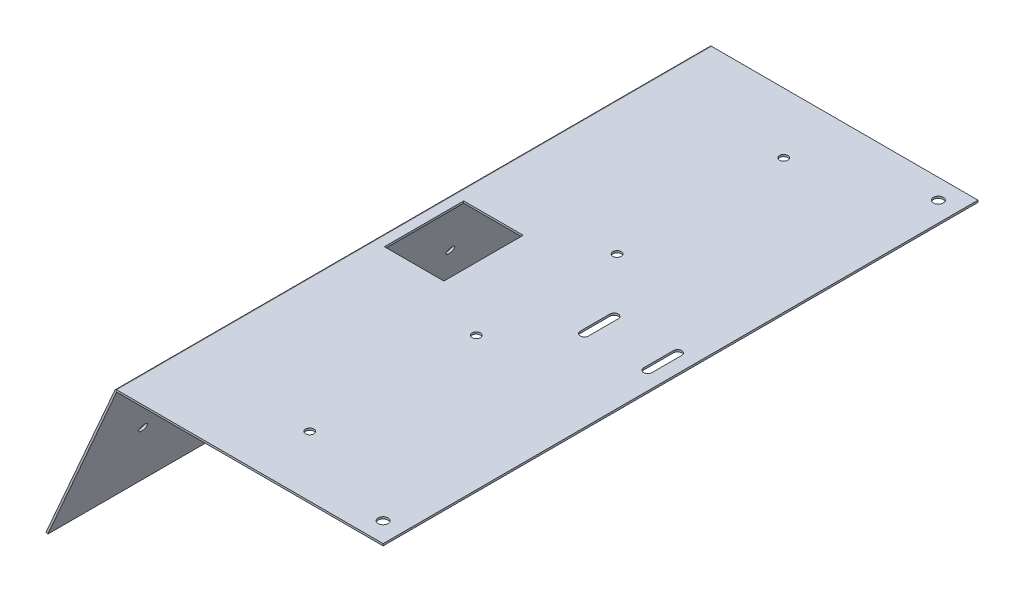
from build123d import *

# Parameters (mm, degrees)
T_LE_DE_BASE_PLI_E1_DEPTH = 300
ESQUISSE7_R               = 2.5
ENL_V_MAT_EXTRU_1_DEPTH   = 339.42205902
ENL_V_MAT_EXTRU_3_DEPTH   = 339.658074862
ESQUISSE14_W              = 30
ESQUISSE14_H              = 40
ENL_V_MAT_EXTRU_4_DEPTH   = 339.658074862
ESQUISSE15_R              = 2.1
ENL_V_MAT_EXTRU_5_DEPTH   = 339.658074862
ESQUISSE16_R              = 2.1
ENL_V_MAT_EXTRU_6_DEPTH   = 339.658074862


# Read off the part's stored shape, not the designer's step: Tôle de base pliée1
with BuildPart() as part:
    # Tôle de base pliée1 outline → Tôle de base pliée1 (new body)
    with BuildSketch(Plane.XY):
        with BuildLine():
            Line((-0.26214176, -0.599181166), (-35, -80))
            Line((-35, -80), (-34.083842665, -80.400818834))
            Line((-34.083842665, -80.400818834), (0.654015575, -1))
            Line((0.654015575, -1), (135, -1))
            Line((135, -1), (135, 0))
            Line((135, 0), (0.654015575, 0))
            ThreePointArc((0.654015575, 0), (0.10666689, -0.163095336), (-0.26214176, -0.599181166))
        make_face()
    extrude(amount=T_LE_DE_BASE_PLI_E1_DEPTH)

    # Esquisse7 → Enlèv. mat.-Extru.1 (cut, through all)
    with BuildSketch(Plane(origin=(0, -1, 0), x_dir=(-1, 0, 0), z_dir=(0, -1, 0))):
        with Locations(Location((-125, -290, 0), (0, 0, 90))):
            Circle(ESQUISSE7_R)
        with Locations(Location((-125, -10, 0), (0, 0, 90))):
            Circle(ESQUISSE7_R)
    extrude(amount=-ENL_V_MAT_EXTRU_1_DEPTH, mode=Mode.SUBTRACT)

    # Esquisse10 → Enlèv. mat.-Extru.3 (cut, through all)
    with BuildSketch(Plane(origin=(0, 0, 0), x_dir=(1, 0, 0), z_dir=(0, 1, 0))):
        with BuildLine():
            Line((96.1, -142.5), (96.1, -157.5))
            ThreePointArc((96.1, -157.5), (94, -159.6), (91.9, -157.5))
            Line((91.9, -157.5), (91.9, -142.5))
            ThreePointArc((91.9, -142.5), (94, -140.4), (96.1, -142.5))
        make_face()
        with BuildLine():
            Line((128.1, -142.5), (128.1, -157.5))
            ThreePointArc((128.1, -157.5), (126, -159.6), (123.9, -157.5))
            Line((123.9, -157.5), (123.9, -142.5))
            ThreePointArc((123.9, -142.5), (126, -140.4), (128.1, -142.5))
        make_face()
    extrude(amount=-ENL_V_MAT_EXTRU_3_DEPTH, mode=Mode.SUBTRACT)

    # Esquisse14 → Enlèv. mat.-Extru.4 (cut, through all)
    with BuildSketch(Plane(origin=(0, 0, 0), x_dir=(1, 0, 0), z_dir=(0, 1, 0))):
        with Locations((20.654015575, -150)):
            Rectangle(ESQUISSE14_W, ESQUISSE14_H)
    extrude(amount=-ENL_V_MAT_EXTRU_4_DEPTH, mode=Mode.SUBTRACT)

    # Esquisse15 → Enlèv. mat.-Extru.5 (cut, through all)
    with BuildSketch(Plane(origin=(0, 0, 0), x_dir=(1, 0, 0), z_dir=(0, 1, 0))):
        with Locations(Location((67.5, -114.5, 0), (0, 0, 270))):
            Circle(ESQUISSE15_R)
        with Locations(Location((67.5, -30.5, 0), (0, 0, 270))):
            Circle(ESQUISSE15_R)
        with Locations(Location((67.5, -269.5, 0), (0, 0, 270))):
            Circle(ESQUISSE15_R)
        with Locations(Location((67.5, -185.5, 0), (0, 0, 270))):
            Circle(ESQUISSE15_R)
    extrude(amount=-ENL_V_MAT_EXTRU_5_DEPTH, mode=Mode.SUBTRACT)

    # Esquisse16 → Enlèv. mat.-Extru.6 (cut, through all)
    with BuildSketch(Plane(origin=(0, 0, 0), x_dir=(0, 0, 1), z_dir=(-0.9161573349021892, 0.40081883401970764, 0))):
        with Locations(Location((114.5, -43.660622991, 0), (0, 0, 270))):
            Circle(ESQUISSE16_R)
        with Locations(Location((30.5, -43.660622991, 0), (0, 0, 270))):
            Circle(ESQUISSE16_R)
        with Locations(Location((269.5, -43.660622991, 0), (0, 0, 90))):
            Circle(ESQUISSE16_R)
        with Locations(Location((185.5, -43.660622991, 0), (0, 0, 90))):
            Circle(ESQUISSE16_R)
    extrude(amount=-ENL_V_MAT_EXTRU_6_DEPTH, mode=Mode.SUBTRACT)


solid = part.part
